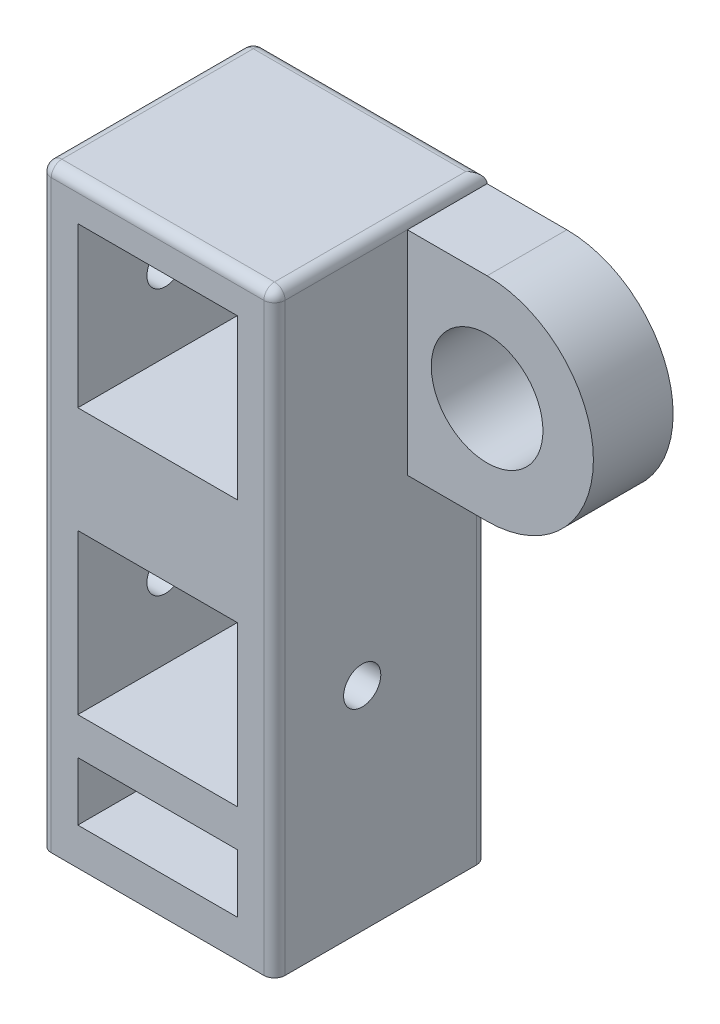
from build123d import *

# Parameters (mm, degrees)
SKETCH1_W           = 22
SKETCH1_H           = 56
SKETCH1_W_2         = 15
SKETCH1_H_2         = 15
BOSS_EXTRUDE1_DEPTH = 20
SKETCH2_W           = 15
SKETCH2_H           = 15
SKETCH2_H_2         = 5.5
CUT_EXTRUDE1_DEPTH  = 15.5
SKETCH4_R           = 5.25
BOSS_EXTRUDE3_DEPTH = 7.5
FILLET4_R           = 1
SKETCH6_R           = 1.75
CUT_EXTRUDE2_DEPTH  = 10
CUT_EXTRUDE3_START  = -10
SKETCH7_R           = 1.75
CUT_EXTRUDE3_DEPTH  = 10


with BuildPart() as part:
    # Sketch1 → Boss-Extrude1 (new body)
    with BuildSketch(Plane.XY):
        with Locations((-14.096172604, 14.333947726)):
            Rectangle(SKETCH1_W, SKETCH1_H)
        with Locations((-14.096172604, 31.333947726)):
            Rectangle(SKETCH1_W_2, SKETCH1_H_2, mode=Mode.SUBTRACT)
    extrude(amount=BOSS_EXTRUDE1_DEPTH)

    # Sketch2 → Cut-Extrude1 (cut)
    with BuildSketch(Plane.XY.offset(20)):
        with Locations((-14.096172604, 6.333947726)):
            Rectangle(SKETCH2_W, SKETCH2_H)
        with Locations((-14.096172604, -7.416052274)):
            Rectangle(SKETCH2_W, SKETCH2_H_2)
    extrude(amount=-CUT_EXTRUDE1_DEPTH, mode=Mode.SUBTRACT)

    # Sketch4 → Boss-Extrude3 (add)
    with BuildSketch(Plane(origin=(0, 0, 0), x_dir=(-1, 0, 0), z_dir=(0, 0, -1))):
        with BuildLine():
            Line((-4.403827396, 41.333947726), (3.096172604, 41.333947726))
            Line((3.096172604, 41.333947726), (3.096172604, 21.333947726))
            Line((3.096172604, 21.333947726), (-4.403827396, 21.333947726))
            ThreePointArc((-4.403827396, 21.333947726), (-14.403827396, 31.333947726), (-4.403827396, 41.333947726))
        make_face()
        with Locations((-4.403827396, 31.333947726)):
            Circle(SKETCH4_R, mode=Mode.SUBTRACT)
    extrude(amount=-BOSS_EXTRUDE3_DEPTH)

    # Fillet4
    fillet4_edges = [part.edges().sort_by_distance(p)[0] for p in [
        (-3.096172604, 14.333947726, 20),
        (-25.096172604, 14.333947726, 0),
        (-25.096172604, 14.333947726, 20),
        (-14.096172604, 42.333947726, 20),
        (-3.096172604, 42.333947726, 10),
        (-14.096172604, 42.333947726, 0),
        (-25.096172604, 42.333947726, 10),
        (-3.096172604, 3.833947726, 0),
    ]]
    fillet(fillet4_edges, radius=FILLET4_R - 0.0001)  # a hair under: the kernel refuses the full size

    # Sketch6 → Cut-Extrude2 (cut)
    with BuildSketch(Plane.ZY.offset(25.096172604)):
        with Locations((11.75, 31.333947726)):
            Circle(SKETCH6_R)
        with Locations((11.75, 6.333947726)):
            Circle(SKETCH6_R)
    extrude(amount=-CUT_EXTRUDE2_DEPTH, mode=Mode.SUBTRACT)

    # Sketch7 → Cut-Extrude3 (cut)
    with BuildSketch(Plane(origin=(-3.096172604, 0, 0), x_dir=(0, 0, -1), z_dir=(1, 0, 0)).offset(CUT_EXTRUDE3_START)):
        with Locations(Location((-11.75, 6.333947726, 0), (0, 0, 180))):
            Circle(SKETCH7_R)
    extrude(amount=CUT_EXTRUDE3_DEPTH, mode=Mode.SUBTRACT)


solid = part.part
